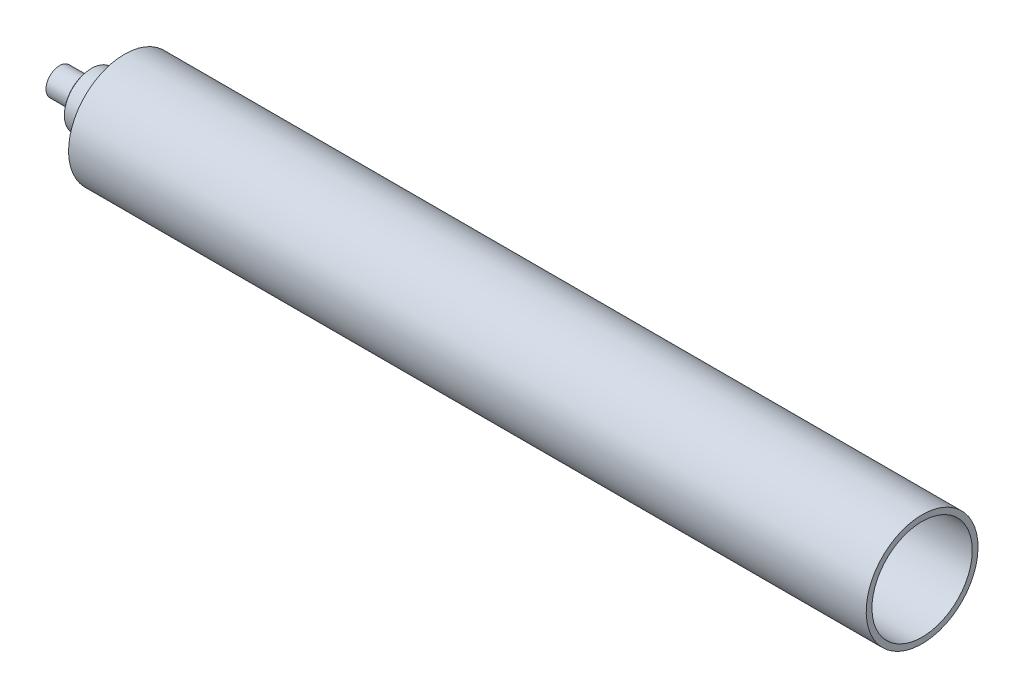
from build123d import *

# Parameters (mm, degrees)
SKETCH19_R         = 4
CUT_EXTRUDE3_DEPTH = 25.4


with BuildPart() as part:
    # Sketch1 → Revolve1 (revolve)
    with BuildSketch(Plane.XY):
        with BuildLine():
            Line((0, 0), (0, 11.938))
            Line((0, 11.938), (24.765, 11.938))
            ThreePointArc((24.765, 11.938), (26.561051224, 12.681948776), (27.305, 14.478))
            Line((27.305, 14.478), (27.305, 22.933028409))
            Line((27.305, 22.933028409), (28.104406531, 23.876))
            Line((28.104406531, 23.876), (57.15, 23.876))
            Line((57.15, 23.876), (57.15, 49.2125))
            Line((57.15, 49.2125), (759.206, 49.2125))
            Line((759.206, 49.2125), (759.206, 44.1325))
            Line((759.206, 44.1325), (62.23, 44.1325))
            Line((62.23, 44.1325), (62.23, 0))
            Line((62.23, 0), (0, 0))
        make_face()
    revolve(axis=Axis((62.23, 0, 0), (-1, 0, 0)))

    # Sketch16 → Cut-Revolve1 (revolve, cut)
    with BuildSketch(Plane(origin=(0, 0, 0), x_dir=(1, 0, 0), z_dir=(0, 1, 0))):
        Polygon((0, 0), (0, 8.35025), (1.905, 6.556375), (1.905, 0), align=None)
    revolve(axis=Axis((1.905, 0, 0), (-1, 0, 0)), mode=Mode.SUBTRACT)

    # Sketch19 → Cut-Extrude3 (cut)
    with BuildSketch(Plane.ZY.offset(-1.905)):
        Circle(SKETCH19_R)
    extrude(amount=-CUT_EXTRUDE3_DEPTH, mode=Mode.SUBTRACT)

    # Sketch32 → Cut-Revolve6 (revolve, cut)
    with BuildSketch(Plane(origin=(0, 0, 0), x_dir=(1, 0, 0), z_dir=(0, 1, 0))):
        Polygon((27.305, 0), (28.575, 0), (27.305, 6.351059428), align=None)
    revolve(axis=Axis((27.305, 0, 0), (1, 0, 0)), mode=Mode.SUBTRACT)


solid = part.part
